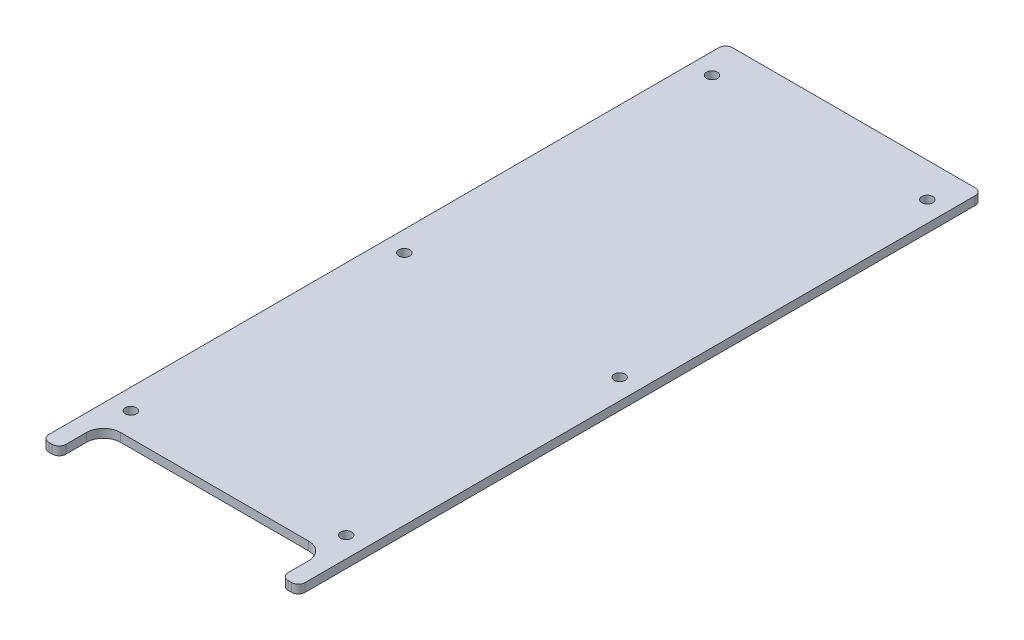
from build123d import *

# Parameters (mm, degrees)
SKETCH1_R           = 2.032
BOSS_EXTRUDE1_DEPTH = 3.175
FILLET1_R           = 2.54
FILLET2_R           = 2.54
FILLET3_R           = 6.35


with BuildPart() as part:
    # Sketch1 → Boss-Extrude1 (new body)
    with BuildSketch(Plane(origin=(0, 0, 0), x_dir=(1, 0, 0), z_dir=(0, 1, 0))):
        Polygon((47.625, 127), (-47.625, 127), (-47.625, -127), (-41.275, -127), (-41.275, -110.49), (41.275, -110.49), (41.275, -127), (47.625, -127), align=None)
        with Locations((-39.999684148, -101.6)):
            Circle(SKETCH1_R, mode=Mode.SUBTRACT)
        with Locations((39.999684148, -101.6)):
            Circle(SKETCH1_R, mode=Mode.SUBTRACT)
        with Locations((-39.999684148, 0)):
            Circle(SKETCH1_R, mode=Mode.SUBTRACT)
        with Locations((-39.999684148, 114.3)):
            Circle(SKETCH1_R, mode=Mode.SUBTRACT)
        with Locations((39.999684148, 0)):
            Circle(SKETCH1_R, mode=Mode.SUBTRACT)
        with Locations((39.999684148, 114.3)):
            Circle(SKETCH1_R, mode=Mode.SUBTRACT)
    extrude(amount=BOSS_EXTRUDE1_DEPTH)

    # Fillet1
    fillet1_edges = [part.edges().sort_by_distance(p)[0] for p in [
        (-47.625, 1.5875, -127),
        (47.625, 1.5875, -127),
        (47.625, 1.5875, 127),
        (-47.625, 1.5875, 127),
    ]]
    fillet(fillet1_edges, radius=FILLET1_R)

    # Fillet2
    fillet2_edges = [part.edges().sort_by_distance(p)[0] for p in [
        (41.275, 1.5875, 127),
        (-41.275, 1.5875, 127),
    ]]
    fillet(fillet2_edges, radius=FILLET2_R)

    # Fillet3
    fillet3_edges = [part.edges().sort_by_distance(p)[0] for p in [
        (41.275, 1.5875, 110.49),
        (-41.275, 1.5875, 110.49),
    ]]
    fillet(fillet3_edges, radius=FILLET3_R)


solid = part.part
